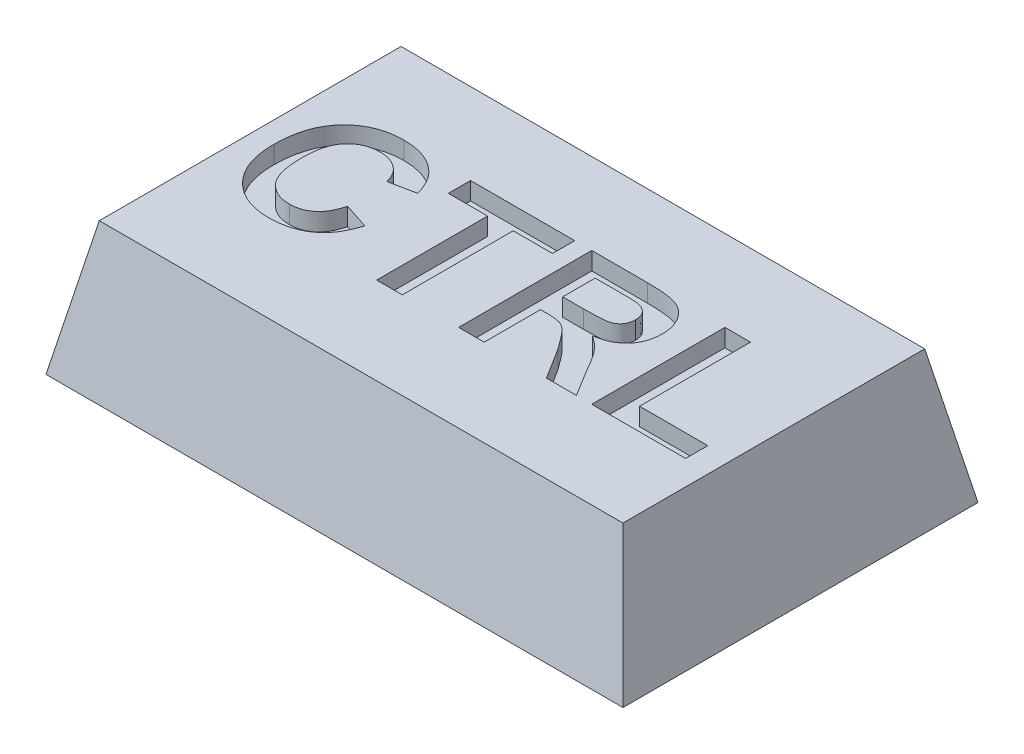
from build123d import *

# Parameters (mm, degrees)
SKETCH1_W               = 13
SKETCH1_H               = 8
BOSS_EXTRUDE1_DEPTH     = 3
CUT_EXTRUDE1_DEPTH      = 16.556349186
CUT_EXTRUDE1_DEPTH_BACK = 16.556349186
CUT_EXTRUDE2_DEPTH      = 16.556349186
CUT_EXTRUDE2_DEPTH_BACK = 16.556349186
SKETCH4_R               = 1.8
CUT_EXTRUDE3_DEPTH      = 0.8
SKETCH5_W               = 8
SKETCH5_H               = 1
BOSS_EXTRUDE2_DEPTH     = 2
FILLET1_R               = 4
CUT_EXTRUDE4_DEPTH      = 0.4


with BuildPart() as part:
    # Sketch1 → Boss-Extrude1 (new body)
    with BuildSketch(Plane(origin=(0, 0, 0), x_dir=(1, 0, 0), z_dir=(0, 1, 0))):
        with Locations((6.5, 4)):
            Rectangle(SKETCH1_W, SKETCH1_H)
    extrude(amount=BOSS_EXTRUDE1_DEPTH)

    # Sketch2 → Cut-Extrude1 (cut, two sides: drawn at the far end of the back side and taken through both)
    with BuildSketch(Plane.XY.offset(-CUT_EXTRUDE1_DEPTH_BACK)):
        Polygon((0, 0), (0.6, 3), (0, 3), align=None)
        Polygon((13, 0), (12.4, 3), (13, 3), align=None)
    extrude(amount=CUT_EXTRUDE1_DEPTH + CUT_EXTRUDE1_DEPTH_BACK, mode=Mode.SUBTRACT)

    # Sketch3 → Cut-Extrude2 (cut, two sides: drawn at the far end of the back side and taken through both)
    with BuildSketch(Plane(origin=(0, 0, 0), x_dir=(0, 0, -1), z_dir=(1, 0, 0)).offset(-CUT_EXTRUDE2_DEPTH_BACK)):
        Polygon((0, 0), (0.6, 3), (0, 3), align=None)
        Polygon((8, 3), (7.4, 3), (8, 0), align=None)
    extrude(amount=CUT_EXTRUDE2_DEPTH + CUT_EXTRUDE2_DEPTH_BACK, mode=Mode.SUBTRACT)

    # Sketch4 → Cut-Extrude3 (cut)
    with BuildSketch(Plane.XZ):
        with Locations(Location((6.50000125, -3.75, 0), (0, 0, 270))):
            Circle(SKETCH4_R)
    extrude(amount=-CUT_EXTRUDE3_DEPTH, mode=Mode.SUBTRACT)

    # Sketch5 → Boss-Extrude2 (add)
    with BuildSketch(Plane.XZ):
        with Locations((6.500011, -7.5)):
            Rectangle(SKETCH5_W, SKETCH5_H)
    extrude(amount=BOSS_EXTRUDE2_DEPTH)

    # Fillet1
    # the kernel refuses this fillet: 4 mm, written as the material it takes off along each edge
    with BuildSketch(Plane(origin=(10.500011, -2, -16.660254038), x_dir=(0, 1, 0), z_dir=(0, 0, 1)), Plane(origin=(2.500011, -2, 1.660254038), x_dir=(0, 1, 0), z_dir=(0, 0, -1))) as fillet1_piece_1:
        with BuildLine():
            CenterArc((4, 3.464101615), FILLET1_R, 180, 60)
            Line((0, 3.464101615), (-0.08, 3.464101615))
            Line((-0.08, 3.464101615), (-0.08, 0))
            Line((-0.08, 0), (0, -0.08))
            ThreePointArc((0, -0.08), (1, -0.08), (1.96, -0.069282032))
            Line((1.96, -0.069282032), (2, 0))
        make_face()
    extrude(amount=18.320508076, mode=Mode.SUBTRACT)

    # Sketch6 → Cut-Extrude4 (cut)
    # profile 1 of 4: a face of its own
    with BuildSketch(Plane(origin=(0, 3, 0), x_dir=(1, 0, 0), z_dir=(0, 1, 0))):
        with BuildLine():
            Line((3.114763417, 3.682334856), (3.691686494, 3.490027164))
            add(Edge.make_bspline(
                [(3.691686494, 3.490027164), (3.679961641, 3.452199771), (3.657000691, 3.378121836), (3.614840538, 3.271950566), (3.566631057, 3.17355681), (3.514105967, 3.081788933), (3.453998837, 2.999017599), (3.389674784, 2.922502296), (3.319221195, 2.853854584), (3.242985709, 2.792927875), (3.161702135, 2.739049061), (3.074426278, 2.693500424), (2.982460606, 2.654270563), (2.884872536, 2.622486105), (2.782309727, 2.597031579), (2.674290947, 2.580218726), (2.561321499, 2.568819056), (2.484184337, 2.567583054), (2.444691302, 2.566950241)],
                knots=[0, 0, 0, 0, 1.126640671, 2.206316847, 3.246446654, 4.24268115, 5.210795778, 6.153057602, 7.084219323, 8.004711971, 8.926421631, 9.854560063, 10.802134612, 11.768317461, 12.772025444, 13.805668576, 14.876536225, 16, 16, 16, 16], degree=3))
            add(Edge.make_bspline(
                [(2.444691302, 2.566950241), (2.39594522, 2.567958204), (2.300060219, 2.569940898), (2.159837488, 2.589899449), (2.026211566, 2.621039548), (1.898991292, 2.664152473), (1.779025843, 2.721255434), (1.665220727, 2.789999995), (1.558404176, 2.871781783), (1.458950921, 2.965222461), (1.368595233, 3.069608709), (1.290460938, 3.184376454), (1.223697885, 3.307908898), (1.169736544, 3.440795057), (1.127542416, 3.582898481), (1.097985342, 3.734022688), (1.079490404, 3.894215284), (1.07738329, 4.003997359), (1.076301879, 4.060339664)],
                knots=[0, 0, 0, 0, 1.025049111, 2.016302254, 2.973197159, 3.90886983, 4.83646737, 5.763135642, 6.70136783, 7.661478232, 8.629732022, 9.600038443, 10.576877021, 11.5787097, 12.612181225, 13.690866959, 14.814907849, 16, 16, 16, 16], degree=3))
            add(Edge.make_bspline(
                [(1.076301879, 4.060339664), (1.077378416, 4.119685986), (1.079478544, 4.235459834), (1.09800813, 4.403785096), (1.126774207, 4.562421842), (1.169039649, 4.710386463), (1.222208021, 4.84872028), (1.289052131, 4.976050067), (1.366407039, 5.094073475), (1.456352649, 5.200627283), (1.556259151, 5.295232655), (1.663321324, 5.37888938), (1.778537964, 5.449071375), (1.901278577, 5.506462538), (2.031707782, 5.550874644), (2.169568928, 5.582854847), (2.314974812, 5.601469381), (2.414389536, 5.604079668), (2.465123994, 5.605411779)],
                knots=[0, 0, 0, 0, 1.212648312, 2.365655595, 3.457000981, 4.504219827, 5.506356588, 6.480637568, 7.437950897, 8.385265166, 9.323599949, 10.245787653, 11.157260172, 12.074946661, 13.00980897, 13.968233668, 14.963125779, 16, 16, 16, 16], degree=3))
            add(Edge.make_bspline(
                [(2.465123994, 5.605411779), (2.509432357, 5.604295323), (2.596304799, 5.602106363), (2.723520669, 5.587234486), (2.844085713, 5.561135336), (2.958651622, 5.525907287), (3.066566226, 5.479415633), (3.168022853, 5.42260331), (3.263370233, 5.355770915), (3.320818993, 5.303566899), (3.349739379, 5.277286779)],
                knots=[0, 0, 0, 0, 1.098510076, 2.153775193, 3.169777012, 4.153122333, 5.120892526, 6.076995459, 7.031936742, 8, 8, 8, 8], degree=3))
            add(Edge.make_bspline(
                [(3.349739379, 5.277286779), (3.366501255, 5.260564472), (3.400418731, 5.226727063), (3.445708082, 5.169599928), (3.488648012, 5.108102558), (3.528556981, 5.041185886), (3.56417364, 4.968344222), (3.597211896, 4.890696182), (3.627628978, 4.80794246), (3.644544373, 4.750350982), (3.653224955, 4.720796394)],
                knots=[0, 0, 0, 0, 0.885292881, 1.791380647, 2.722937556, 3.69093542, 4.703306561, 5.754477758, 6.847650944, 8, 8, 8, 8], degree=3))
            Line((3.653224955, 4.720796394), (3.076301879, 4.605411779))
            add(Edge.make_bspline(
                [(3.076301879, 4.605411779), (3.07139827, 4.624334889), (3.061739446, 4.661608452), (3.042196132, 4.715168515), (3.019778409, 4.765992231), (2.991993695, 4.81283475), (2.962479145, 4.857779964), (2.927535582, 4.898832166), (2.889394626, 4.937067243), (2.847781515, 4.97208841), (2.803192338, 5.003188008), (2.756485594, 5.031144611), (2.706812368, 5.053965934), (2.654833438, 5.07242833), (2.600755831, 5.087907659), (2.544098089, 5.097469962), (2.485346838, 5.10481072), (2.445317529, 5.105208489), (2.424859571, 5.105411779)],
                knots=[0, 0, 0, 0, 1.051226935, 2.070641259, 3.064374968, 4.034983734, 4.997599858, 5.953980297, 6.92954377, 7.901109626, 8.875958313, 9.851998019, 10.826131395, 11.811470594, 12.818270757, 13.847890818, 14.900111925, 16, 16, 16, 16], degree=3))
            add(Edge.make_bspline(
                [(2.424859571, 5.105411779), (2.396764359, 5.104844384), (2.341930913, 5.103736998), (2.26178343, 5.091390397), (2.185393769, 5.074159438), (2.113070006, 5.047847852), (2.045260023, 5.014195552), (1.981193156, 4.973287418), (1.921221036, 4.925298669), (1.865323396, 4.869660798), (1.815162862, 4.805367843), (1.771064592, 4.732287064), (1.734481125, 4.649588757), (1.704781167, 4.558084452), (1.681403916, 4.457556551), (1.664710719, 4.347876122), (1.655478879, 4.228968133), (1.653992476, 4.146693318), (1.653224955, 4.104209856)],
                knots=[0, 0, 0, 0, 0.938194206, 1.831074359, 2.704771284, 3.551924377, 4.396294915, 5.230222094, 6.087631332, 6.958733431, 7.860107878, 8.806247581, 9.804197948, 10.875520245, 12.017191412, 13.250061517, 14.580040491, 16, 16, 16, 16], degree=3))
            add(Edge.make_bspline(
                [(1.653224955, 4.104209856), (1.653984918, 4.059123158), (1.655449249, 3.972248036), (1.66467913, 3.846938708), (1.681479073, 3.731687275), (1.70454564, 3.626289209), (1.734395267, 3.530809066), (1.770916868, 3.445412073), (1.814334082, 3.36999822), (1.864579361, 3.304617725), (1.920382418, 3.248456081), (1.980231869, 3.200169854), (2.043774616, 3.15888532), (2.111393029, 3.124919067), (2.183344293, 3.099223975), (2.259037074, 3.080589444), (2.338749102, 3.068743176), (2.393366789, 3.067556262), (2.421253802, 3.066950241)],
                knots=[0, 0, 0, 0, 1.475208372, 2.842499301, 4.107722225, 5.282836115, 6.369007568, 7.375918121, 8.315702116, 9.208439171, 10.065831443, 10.90006451, 11.71996243, 12.54067204, 13.369972975, 14.214060185, 15.088124569, 16, 16, 16, 16], degree=3))
            add(Edge.make_bspline(
                [(2.421253802, 3.066950241), (2.441900329, 3.067465339), (2.482498659, 3.068478203), (2.54250612, 3.074906774), (2.600101045, 3.087174776), (2.655565343, 3.103396988), (2.709114509, 3.123751078), (2.759931745, 3.149861283), (2.809016856, 3.179871086), (2.855351366, 3.215040275), (2.899555718, 3.254524405), (2.939872709, 3.300158218), (2.977270066, 3.350845238), (3.011273346, 3.406924207), (3.043018707, 3.467915109), (3.070027822, 3.534768215), (3.095189234, 3.606403148), (3.108124727, 3.656582206), (3.114763417, 3.682334856)],
                knots=[0, 0, 0, 0, 0.980177776, 1.927374078, 2.859849964, 3.771585772, 4.668674471, 5.574490016, 6.479656464, 7.396337719, 8.332153134, 9.288470092, 10.28125149, 11.318486971, 12.398724812, 13.541284404, 14.738150009, 16, 16, 16, 16], degree=3))
        make_face()
    # profile 2 of 4: a face of its own
    with BuildSketch(Plane(origin=(0, 3, 0), x_dir=(1, 0, 0), z_dir=(0, 1, 0))):
        Polygon((4.883994186, 2.566950241), (4.883994186, 5.066950241), (3.999378802, 5.066950241), (3.999378802, 5.566950241), (6.345532648, 5.566950241), (6.345532648, 5.066950241), (5.460917263, 5.066950241), (5.460917263, 2.566950241), align=None)
    # profile 3 of 4: a face of its own
    with BuildSketch(Plane(origin=(0, 3, 0), x_dir=(1, 0, 0), z_dir=(0, 1, 0))):
        with BuildLine():
            Line((6.730148032, 2.566950241), (6.730148032, 5.566950241))
            Line((6.730148032, 5.566950241), (7.989162455, 5.566950241))
            add(Edge.make_bspline(
                [(7.989162455, 5.566950241), (8.027425148, 5.566714429), (8.10116436, 5.566259975), (8.207805646, 5.562946013), (8.30615285, 5.556003068), (8.396642241, 5.548140126), (8.478839191, 5.536700052), (8.553068692, 5.522994956), (8.619205774, 5.507112639), (8.678215416, 5.488090989), (8.732020222, 5.46632005), (8.782142039, 5.440406508), (8.829131971, 5.410045608), (8.873711736, 5.376283807), (8.916070113, 5.339069229), (8.95504586, 5.297416992), (8.991318037, 5.251947312), (9.024857377, 5.203038499), (9.054403437, 5.150906515), (9.081400778, 5.097225591), (9.103377632, 5.04142448), (9.121530314, 4.983766047), (9.136030956, 4.924375477), (9.146095627, 4.863101777), (9.152378893, 4.800055854), (9.152939801, 4.757470161), (9.153224955, 4.735820433)],
                knots=[0, 0, 0, 0, 1.675828044, 3.229627355, 4.67171229, 5.993455049, 7.206927059, 8.304770529, 9.29850117, 10.183580433, 11.017754134, 11.837875825, 12.650738409, 13.464925643, 14.285328857, 15.117007378, 15.959673368, 16.830859064, 17.711229498, 18.58228265, 19.460420693, 20.334473227, 21.228207035, 22.135446768, 23.052097822, 24, 24, 24, 24], degree=3))
            add(Edge.make_bspline(
                [(9.153224955, 4.735820433), (9.152696037, 4.708547835), (9.151662383, 4.65524966), (9.142150158, 4.577131124), (9.128022075, 4.502494439), (9.1078826, 4.431236203), (9.080191233, 4.364194513), (9.048044941, 4.300430213), (9.009705087, 4.240159591), (8.965432149, 4.183980138), (8.915265763, 4.131842124), (8.85898608, 4.08481851), (8.796994919, 4.042725516), (8.728917272, 4.005805876), (8.655227167, 3.974243584), (8.57560506, 3.947688033), (8.490411399, 3.926074774), (8.431150736, 3.915905089), (8.400821109, 3.910700241)],
                knots=[0, 0, 0, 0, 1.05911256, 2.069797862, 3.05271628, 4.008392045, 4.940519534, 5.866323021, 6.779546087, 7.71056835, 8.640711998, 9.585328432, 10.554502533, 11.547017206, 12.589327225, 13.664782803, 14.804835066, 16, 16, 16, 16], degree=3))
            add(Edge.make_bspline(
                [(8.400821109, 3.910700241), (8.430153265, 3.891273278), (8.487560289, 3.853252066), (8.56698704, 3.790630653), (8.638293416, 3.724904637), (8.692283008, 3.666456974), (8.733768445, 3.615058534), (8.76717131, 3.570104963), (8.803201654, 3.518369923), (8.841506099, 3.459825383), (8.883217021, 3.394989323), (8.926783116, 3.322869329), (8.973116067, 3.244168868), (9.004267632, 3.189192612), (9.020412455, 3.160700241)],
                knots=[0, 0, 0, 0, 1.285445069, 2.515791127, 3.691898215, 4.826622834, 5.420063933, 6.105349801, 6.873086501, 7.723915395, 8.66222816, 9.690593598, 10.803111229, 12, 12, 12, 12], degree=3))
            Line((9.020412455, 3.160700241), (9.383994186, 2.566950241))
            Line((9.383994186, 2.566950241), (8.70971534, 2.566950241))
            Line((8.70971534, 2.566950241), (8.283032648, 3.247839664))
            add(Edge.make_bspline(
                [(8.283032648, 3.247839664), (8.263436835, 3.275108794), (8.226024399, 3.327171169), (8.172017237, 3.401153494), (8.122605477, 3.467011051), (8.079104131, 3.525697749), (8.039312048, 3.575549681), (8.004437476, 3.617435595), (7.975190764, 3.652254301), (7.942098036, 3.686778551), (7.903598161, 3.722259863), (7.85593839, 3.756661015), (7.806996228, 3.78408525), (7.75455861, 3.805010586), (7.69391609, 3.81960112), (7.621014176, 3.828897146), (7.533560664, 3.835755648), (7.470349295, 3.836032035), (7.43627784, 3.83618101)],
                knots=[0, 0, 0, 0, 1.465447777, 2.797841088, 3.997266218, 5.05856206, 5.985598736, 6.780315439, 7.437430484, 7.969193402, 8.866571936, 9.718200644, 10.52825214, 11.309096006, 12.174169268, 13.242355782, 14.513606761, 16, 16, 16, 16], degree=3))
            Line((7.43627784, 3.83618101), (7.307071109, 3.83618101))
            Line((7.307071109, 3.83618101), (7.307071109, 2.566950241))
            Line((7.307071109, 2.566950241), (6.730148032, 2.566950241))
        make_face()
        with BuildLine():
            Line((7.307071109, 4.33618101), (7.771614379, 4.33618101))
            add(Edge.make_bspline(
                [(7.771614379, 4.33618101), (7.807473482, 4.336257858), (7.875791132, 4.336404267), (7.972940191, 4.338524941), (8.059727013, 4.340324879), (8.135632244, 4.344847301), (8.20099549, 4.349329447), (8.255554547, 4.355154611), (8.299769089, 4.362039767), (8.343931986, 4.372744376), (8.389169797, 4.391395045), (8.437384745, 4.417959087), (8.478592867, 4.452419853), (8.514288619, 4.492259984), (8.541519477, 4.539095682), (8.56284768, 4.590840362), (8.57366153, 4.648643838), (8.575403321, 4.688709175), (8.576301879, 4.709378125)],
                knots=[0, 0, 0, 0, 1.697953026, 3.23488743, 4.60134403, 5.807846676, 6.835100678, 7.703488618, 8.405232423, 8.952775585, 9.851109663, 10.713519226, 11.549115941, 12.382556273, 13.233359028, 14.101746968, 15.020727134, 16, 16, 16, 16], degree=3))
            add(Edge.make_bspline(
                [(8.576301879, 4.709378125), (8.575279939, 4.732500619), (8.573308271, 4.777111743), (8.557759416, 4.840593797), (8.530619523, 4.896671451), (8.493346148, 4.945437292), (8.446555299, 4.986615871), (8.390822223, 5.019302699), (8.326560978, 5.043646493), (8.280211619, 5.052636609), (8.255989379, 5.057334856)],
                knots=[0, 0, 0, 0, 1.062977961, 2.050844577, 2.982300261, 3.90936959, 4.856017476, 5.831122378, 6.86654153, 8, 8, 8, 8], degree=3))
            add(Edge.make_bspline(
                [(8.255989379, 5.057334856), (8.247982692, 5.058214619), (8.229005166, 5.060299841), (8.195493103, 5.061639088), (8.152643632, 5.063697656), (8.099938101, 5.064538947), (8.037847381, 5.066013656), (7.966124569, 5.066284449), (7.884997535, 5.067149616), (7.827704469, 5.067019132), (7.797455725, 5.066950241)],
                knots=[0, 0, 0, 0, 0.42127143, 0.998501726, 1.753681744, 2.66564073, 3.755712164, 5.002818897, 6.417592707, 8, 8, 8, 8], degree=3))
            Line((7.797455725, 5.066950241), (7.307071109, 5.066950241))
            Line((7.307071109, 5.066950241), (7.307071109, 4.33618101))
        make_face(mode=Mode.SUBTRACT)
    # profile 4 of 4: a face of its own
    with BuildSketch(Plane(origin=(0, 3, 0), x_dir=(1, 0, 0), z_dir=(0, 1, 0))):
        Polygon((9.730148032, 2.566950241), (9.730148032, 5.566950241), (10.307071109, 5.566950241), (10.307071109, 3.066950241), (11.845532648, 3.066950241), (11.845532648, 2.566950241), align=None)
    extrude(amount=-CUT_EXTRUDE4_DEPTH, mode=Mode.SUBTRACT)


solid = part.part
